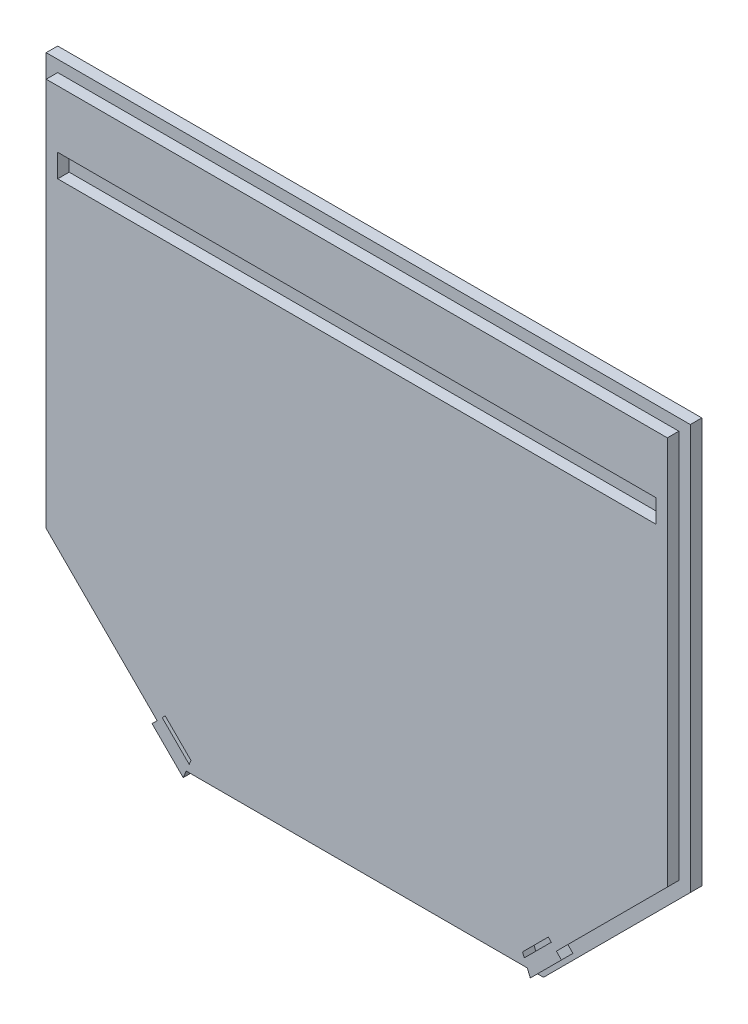
from build123d import *

# Parameters (mm, degrees)
BOSS_EXTRUDE1_DEPTH = 12.7
SKETCH2_W           = 330.2
SKETCH2_H           = 12.7
CUT_EXTRUDE1_DEPTH  = 6.35
CUT_EXTRUDE3_DEPTH  = 6.35


with BuildPart() as part:
    # Sketch1 → Boss-Extrude1 (new body)
    with BuildSketch(Plane.XY):
        Polygon((0, 0), (355.6, 0), (355.6, -223.774), (292.534512242, -286.839487758), (274.574, -304.8), (81.026, -304.8), (63.065487758, -286.839487758), (0, -223.774), align=None)
    extrude(amount=BOSS_EXTRUDE1_DEPTH)

    # Sketch2 → Cut-Extrude1 (cut)
    # profile 1 of 2: a face of its own
    with BuildSketch(Plane.XY.offset(12.7)):
        Polygon((355.6, 0), (0, 0), (0, -223.774), (81.026, -304.8), (274.574, -304.8), (355.6, -223.774), align=None)
        Polygon((67.607470696, -282.401214575), (6.35, -221.143743879), (6.35, -6.35), (349.25, -6.35), (349.25, -221.143743879), (287.992529304, -282.401214575), (290.812329726, -285.221014997), (273.595544723, -302.4378), (271.943743879, -298.45), (83.656256121, -298.45), (82.004455277, -302.4378), (64.787670274, -285.221014997), align=None, mode=Mode.SUBTRACT)
    # profile 2 of 2: a face of its own
    with BuildSketch(Plane.XY.offset(12.7)):
        with Locations((177.8, -44.45)):
            Rectangle(SKETCH2_W, SKETCH2_H)
    extrude(amount=-CUT_EXTRUDE1_DEPTH, mode=Mode.SUBTRACT)

    # Sketch3 → Cut-Extrude3 (cut)
    with BuildSketch(Plane.XY.offset(12.7)):
        Polygon((85.308056965, -294.4622), (70.400831804, -279.554974839), (72.071159443, -277.884647201), (86.286512242, -292.1), align=None)
        Polygon((285.199168196, -279.554974839), (283.528840557, -277.884647201), (269.313487758, -292.1), (270.291943035, -294.4622), align=None)
    extrude(amount=-CUT_EXTRUDE3_DEPTH, mode=Mode.SUBTRACT)


solid = part.part
